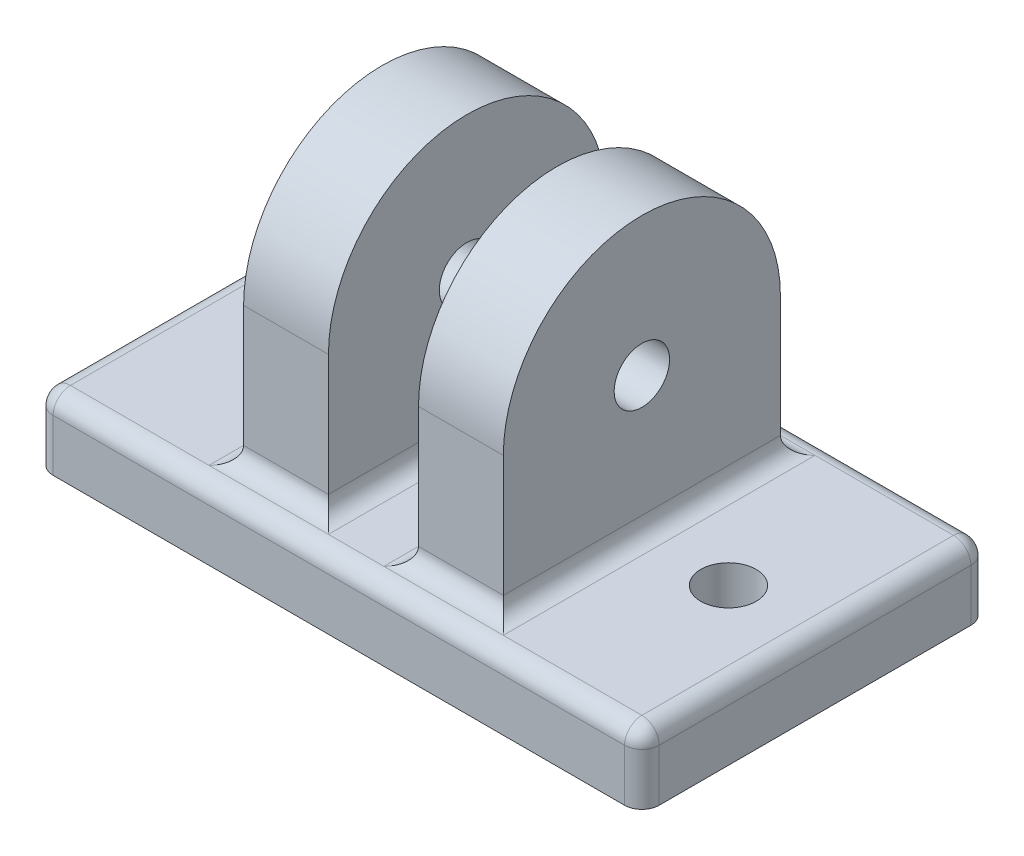
from build123d import *

# Parameters (mm, degrees)
SKETCH1_W               = 20
SKETCH1_H               = 20
BOSS_EXTRUDE1_DEPTH     = 15
CUT_EXTRUDE1_DEPTH      = 17.007810594
CUT_EXTRUDE1_DEPTH_BACK = 17.007810594
SKETCH3_W               = 20
SKETCH3_H               = 16
CUT_EXTRUDE2_DEPTH      = 2.6
CUT_EXTRUDE3_DEPTH      = 17.007810594
CUT_EXTRUDE3_DEPTH_BACK = 17.007810594
SKETCH4_R               = 1.6
SKETCH5_W               = 20
SKETCH5_H               = 4
BOSS_EXTRUDE2_DEPTH     = 17.5
CUT_EXTRUDE4_DEPTH      = 32.320919527
CUT_EXTRUDE4_DEPTH_BACK = 32.320919527
SKETCH6_R               = 1.6
FILLET4_R               = 1


with BuildPart() as part:
    # Sketch1 → Boss-Extrude1 (new body)
    with BuildSketch(Plane.YZ):
        Rectangle(SKETCH1_W, SKETCH1_H)
    extrude(amount=BOSS_EXTRUDE1_DEPTH)

    # Sketch2 → Cut-Extrude1 (cut, two sides: drawn at the far end of the back side and taken through both)
    with BuildSketch(Plane.ZY.offset(-7.5).offset(-CUT_EXTRUDE1_DEPTH_BACK)):
        with BuildLine():
            Line((-10, 10), (-10, 0))
            Line((-10, 0), (-10, -6))
            Line((-10, -6), (-8, -6))
            Line((-8, -6), (-8, 2))
            ThreePointArc((-8, 2), (-5.656854249, 7.656854249), (0, 10))
            Line((0, 10), (-10, 10))
        make_face()
        with BuildLine():
            Line((10, 10), (0, 10))
            ThreePointArc((0, 10), (5.656854249, 7.656854249), (8, 2))
            Line((8, 2), (8, -6))
            Line((8, -6), (10, -6))
            Line((10, -6), (10, 0))
            Line((10, 0), (10, 10))
        make_face()
    extrude(amount=CUT_EXTRUDE1_DEPTH + CUT_EXTRUDE1_DEPTH_BACK, mode=Mode.SUBTRACT)

    # Sketch3 → Cut-Extrude2 (cut, symmetric)
    with BuildSketch(Plane.ZY.offset(-7.5)):
        with Locations((0, 2)):
            Rectangle(SKETCH3_W, SKETCH3_H)
    extrude(amount=CUT_EXTRUDE2_DEPTH, both=True, mode=Mode.SUBTRACT)

    # Sketch4 → Cut-Extrude3 (cut, two sides: drawn at the far end of the back side and taken through both)
    with BuildSketch(Plane.ZY.offset(-7.5).offset(-CUT_EXTRUDE3_DEPTH_BACK)):
        with Locations((0, 2)):
            Circle(SKETCH4_R)
    extrude(amount=CUT_EXTRUDE3_DEPTH + CUT_EXTRUDE3_DEPTH_BACK, mode=Mode.SUBTRACT)

    # Sketch5 → Boss-Extrude2 (add, symmetric)
    with BuildSketch(Plane.ZY.offset(-7.5)):
        with Locations((0, -8)):
            Rectangle(SKETCH5_W, SKETCH5_H)
    extrude(amount=BOSS_EXTRUDE2_DEPTH, both=True)

    # Sketch6 → Cut-Extrude4 (cut, two sides: drawn at the far end of the back side and taken through both)
    with BuildSketch(Plane(origin=(0, -6, 0), x_dir=(1, 0, 0), z_dir=(0, 1, 0)).offset(-CUT_EXTRUDE4_DEPTH_BACK)):
        with Locations(Location((20, 0, 0), (0, 0, 270))):
            Circle(SKETCH6_R)
        with Locations(Location((-5, 0, 0), (0, 0, 270))):
            Circle(SKETCH6_R)
    extrude(amount=CUT_EXTRUDE4_DEPTH + CUT_EXTRUDE4_DEPTH_BACK, mode=Mode.SUBTRACT)

    # Fillet4
    fillet4_edges = [part.edges().sort_by_distance(p)[0] for p in [
        (12.55, -6, -8),
        (7.5, -6, -10),
        (7.5, -6, 10),
        (12.55, -6, 8),
        (2.45, -6, 8),
        (2.45, -6, -8),
        (10.1, -6, 0),
        (4.9, -6, 0),
        (0, -6, 0),
        (15, -6, 0),
        (25, -6, 0),
        (25, -8, -10),
        (25, -8, 10),
        (-10, -8, -10),
        (-10, -8, 10),
        (-10, -6, 0),
    ]]
    fillet(fillet4_edges, radius=FILLET4_R - 0.0001)  # a hair under: the kernel refuses the full size


solid = part.part
